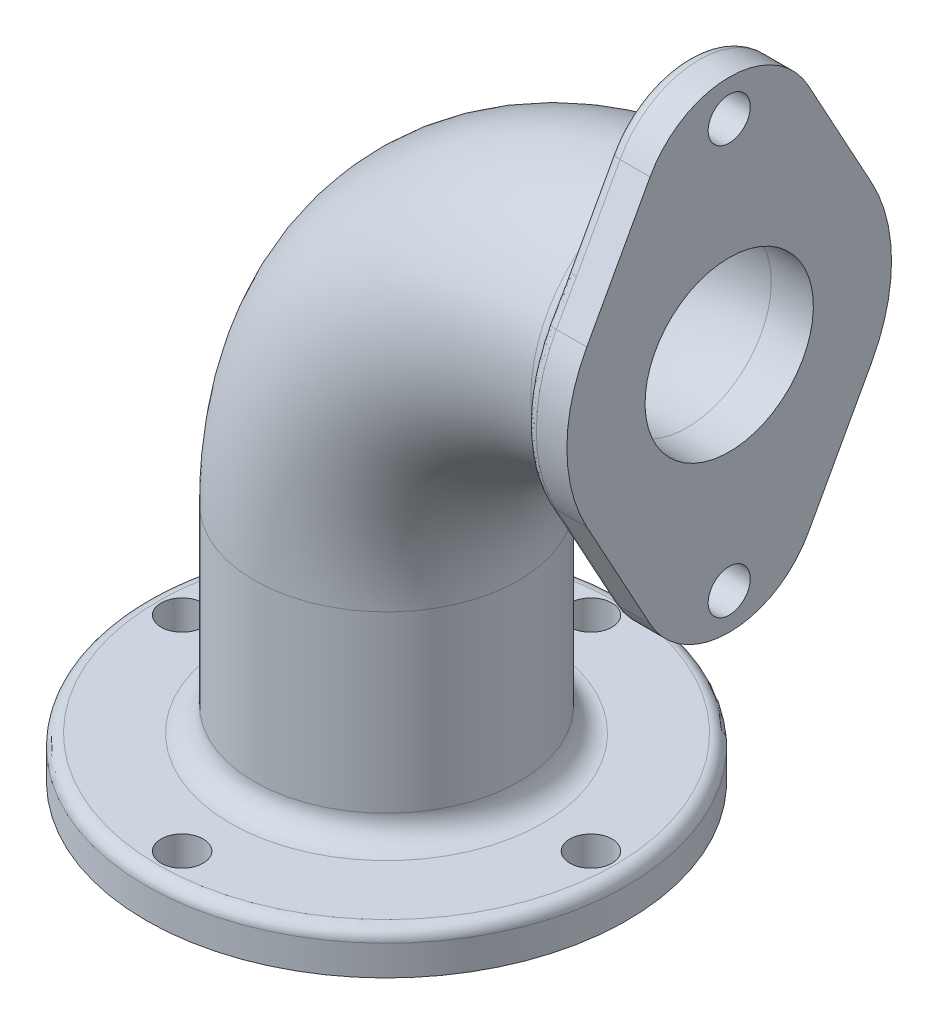
from build123d import *

# Parameters (mm, degrees)
SKETCH1_R           = 40
BOSS_EXTRUDE1_DEPTH = 7
FILLET1_R           = 2
SKETCH2_R           = 3.5
CUT_EXTRUDE1_DEPTH  = 58.00000007
SKETCH3_R           = 22
BOSS_EXTRUDE2_DEPTH = 33
SKETCH4_R           = 14
CUT_EXTRUDE2_DEPTH  = 70.28203236
FILLET2_R           = 4
SWEEP1_OUTLINE_R    = 22
SWEEP1_OUTLINE_R_2  = 14
SWEEP1_ANGLE        = 90
SKETCH7_R           = 3.5
BOSS_EXTRUDE3_DEPTH = 7
SKETCH8_R           = 14
CUT_EXTRUDE6_DEPTH  = 7
FILLET4_R           = 4
FILLET5_R           = 2


# Read off the part's stored shape, not the designer's step: Sweep1
with BuildPart() as part:
    # Sketch1 → Boss-Extrude1 (new body)
    with BuildSketch(Plane(origin=(0, 0, 0), x_dir=(1, 0, 0), z_dir=(0, 1, 0))):
        with Locations(Location((0, 0, 0), (0, 0, 270))):
            Circle(SKETCH1_R)
    extrude(amount=BOSS_EXTRUDE1_DEPTH)

    # Fillet1
    fillet1_edges = [part.edges().sort_by_distance(p)[0] for p in [
        (0, 7, -40),
    ]]
    fillet(fillet1_edges, radius=FILLET1_R)

    # Sketch2 → Cut-Extrude1 (cut, through all)
    with BuildSketch(Plane(origin=(0, 7, 0), x_dir=(1, 0, 0), z_dir=(0, 1, 0))):
        with Locations(Location((0, 34, 0), (0, 0, 270))):
            Circle(SKETCH2_R)
        with Locations(Location((34, 0, 0), (0, 0, 270))):
            Circle(SKETCH2_R)
        with Locations(Location((0, -34, 0), (0, 0, 270))):
            Circle(SKETCH2_R)
        with Locations(Location((-34, 0, 0), (0, 0, 270))):
            Circle(SKETCH2_R)
    extrude(amount=-CUT_EXTRUDE1_DEPTH, mode=Mode.SUBTRACT)

    # Sketch3 → Boss-Extrude2 (add)
    with BuildSketch(Plane(origin=(0, 7, 0), x_dir=(1, 0, 0), z_dir=(0, 1, 0))):
        with Locations(Location((0, 0, 0), (0, 0, 270))):
            Circle(SKETCH3_R)
    extrude(amount=BOSS_EXTRUDE2_DEPTH)

    # Sketch4 → Cut-Extrude2 (cut, through all)
    with BuildSketch(Plane(origin=(0, 40, 0), x_dir=(1, 0, 0), z_dir=(0, 1, 0))):
        with Locations(Location((0, 0, 0), (0, 0, 270))):
            Circle(SKETCH4_R)
    extrude(amount=-CUT_EXTRUDE2_DEPTH, mode=Mode.SUBTRACT)

    # Fillet2
    fillet2_edges = [part.edges().sort_by_distance(p)[0] for p in [
        (0, 7, -22),
    ]]
    fillet(fillet2_edges, radius=FILLET2_R)

    # Sweep1 outline → Sweep1 (revolve)
    with BuildSketch(Plane(origin=(50, 40, 0), x_dir=(0, 1, 0), z_dir=(1, 0, 0))):
        with Locations((50, 0)):
            Circle(SWEEP1_OUTLINE_R)
        with Locations((50, 0)):
            Circle(SWEEP1_OUTLINE_R_2, mode=Mode.SUBTRACT)
    revolve(axis=Axis((50, 40, 0), (0, 0, 1)), revolution_arc=SWEEP1_ANGLE)

    # Sketch7 → Boss-Extrude3 (add)
    with BuildSketch(Plane(origin=(50, 0, 0), x_dir=(0, 0, -1), z_dir=(1, 0, 0))):
        with BuildLine():
            Line((-23.686249175, 102.96), (-13.15902732, 122.2))
            ThreePointArc((-13.15902732, 122.2), (0, 130), (13.15902732, 122.2))
            Line((13.15902732, 122.2), (23.686249175, 102.96))
            ThreePointArc((23.686249175, 102.96), (27, 90), (23.686249175, 77.04))
            Line((23.686249175, 77.04), (13.15902732, 57.8))
            ThreePointArc((13.15902732, 57.8), (0, 50), (-13.15902732, 57.8))
            Line((-13.15902732, 57.8), (-23.686249175, 77.04))
            ThreePointArc((-23.686249175, 77.04), (-27, 90), (-23.686249175, 102.96))
        make_face()
        with Locations(Location((0, 124, 0), (0, 0, 90))):
            Circle(SKETCH7_R, mode=Mode.SUBTRACT)
        with Locations(Location((0, 56, 0), (0, 0, 270))):
            Circle(SKETCH7_R, mode=Mode.SUBTRACT)
    extrude(amount=BOSS_EXTRUDE3_DEPTH)

    # Sketch8 → Cut-Extrude6 (cut)
    with BuildSketch(Plane(origin=(57, 0, 0), x_dir=(0, 0, -1), z_dir=(1, 0, 0))):
        with Locations(Location((0, 90, 0), (0, 0, 90))):
            Circle(SKETCH8_R)
    extrude(amount=-CUT_EXTRUDE6_DEPTH, mode=Mode.SUBTRACT)

    # Fillet4
    fillet4_edges = [part.edges().sort_by_distance(p)[0] for p in [
        (50, 68, 0),
    ]]
    fillet(fillet4_edges, radius=FILLET4_R)

    # Fillet5
    fillet5_edges = [part.edges().sort_by_distance(p)[0] for p in [
        (50, 90, 27),
        (50, 67.42, 18.422638248),
        (50, 50, 0),
        (50, 67.42, -18.422638248),
        (50, 90, -27),
        (50, 112.58, -18.422638248),
        (50, 130, 0),
        (50, 112.58, 18.422638248),
    ]]
    fillet(fillet5_edges, radius=FILLET5_R)


solid = part.part
